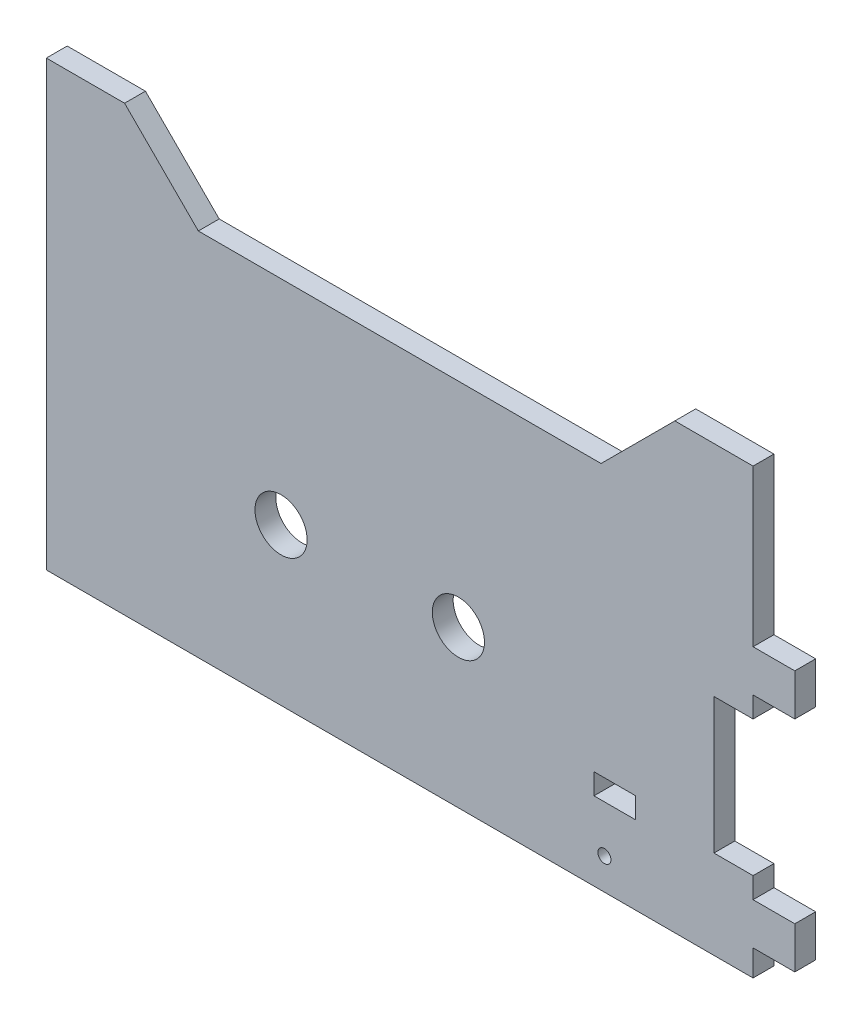
from build123d import *

# Parameters (mm, degrees)
SKETCH1_R           = 5
SKETCH1_R_2         = 1.25
SKETCH1_W           = 8
SKETCH1_H           = 4
BOSS_EXTRUDE1_DEPTH = 4
BOSS_EXTRUDE2_DEPTH = 4


with BuildPart() as part:
    # Sketch1 → Boss-Extrude1 (new body)
    with BuildSketch(Plane.XY):
        Polygon((49, 30), (56.5, 30), (56.5, 25), (64.5, 25), (64.5, 17), (56.5, 17), (56.5, 13), (49, 13), (49, -13), (56.5, -13), (56.5, -17), (64.5, -17), (64.5, -25), (56.5, -25), (56.5, -30), (49, -30), (-79, -30), (-79, 30), align=None)
        Circle(SKETCH1_R, mode=Mode.SUBTRACT)
        with Locations((-34, 0)):
            Circle(SKETCH1_R, mode=Mode.SUBTRACT)
        with Locations((28, -24)):
            Circle(SKETCH1_R_2, mode=Mode.SUBTRACT)
        with Locations((30, -13)):
            Rectangle(SKETCH1_W, SKETCH1_H, mode=Mode.SUBTRACT)
    extrude(amount=BOSS_EXTRUDE1_DEPTH)

    # Sketch2 → Boss-Extrude2 (add)
    with BuildSketch(Plane.XY):
        Polygon((-79, 30), (56.5, 30), (56.5, 55), (41.5, 55), (27.357864376, 40.857864376), (-49.857864376, 40.857864376), (-64, 55), (-79, 55), align=None)
    extrude(amount=BOSS_EXTRUDE2_DEPTH)


solid = part.part
